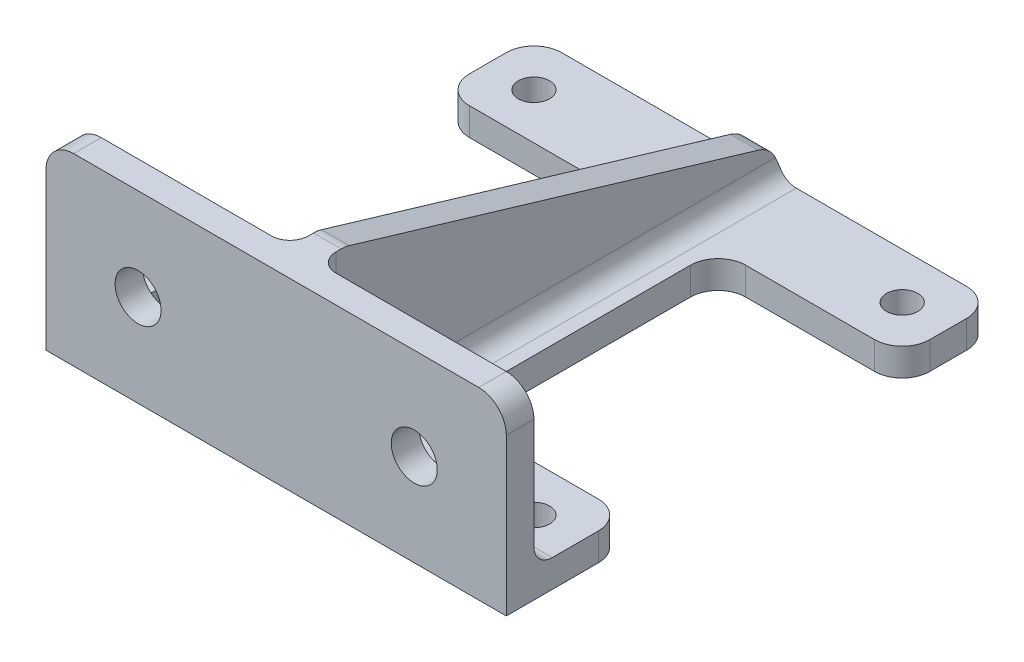
from build123d import *

# Parameters (mm, degrees)
ESQUISSE1_W             = 50
ESQUISSE1_H             = 50
ESQUISSE1_R             = 1.7
BOSS_EXTRU_1_DEPTH      = 3
ESQUISSE2_W             = 50
ESQUISSE2_H             = 20
ESQUISSE2_R             = 2.5
BOSS_EXTRU_2_DEPTH      = 3
BOSS_EXTRU_3_DEPTH      = 1.5
BOSS_EXTRU_3_DEPTH_BACK = 1.5
CONG_1_R                = 3
CONG_2_R                = 3
CONG_3_R                = 2
ESQUISSE4_W             = 20
ESQUISSE4_H             = 30
ENL_V_MAT_EXTRU_1_DEPTH = 73.725511411
CONG_4_R                = 3


with BuildPart() as part:
    # Esquisse1 → Boss.-Extru.1 (new body)
    with BuildSketch(Plane(origin=(0, 0, 0), x_dir=(1, 0, 0), z_dir=(0, 1, 0))):
        with Locations((25, 25)):
            Rectangle(ESQUISSE1_W, ESQUISSE1_H)
        with Locations((5, 5)):
            Circle(ESQUISSE1_R, mode=Mode.SUBTRACT)
        with Locations((5, 45)):
            Circle(ESQUISSE1_R, mode=Mode.SUBTRACT)
        with Locations((45, 45)):
            Circle(ESQUISSE1_R, mode=Mode.SUBTRACT)
        with Locations((45, 5)):
            Circle(ESQUISSE1_R, mode=Mode.SUBTRACT)
    extrude(amount=BOSS_EXTRU_1_DEPTH)

    # Esquisse2 → Boss.-Extru.2 (add)
    with BuildSketch(Plane.XY):
        with Locations((25, 10)):
            Rectangle(ESQUISSE2_W, ESQUISSE2_H)
        with Locations((10, 10)):
            Circle(ESQUISSE2_R, mode=Mode.SUBTRACT)
        with Locations((40, 10)):
            Circle(ESQUISSE2_R, mode=Mode.SUBTRACT)
    extrude(amount=BOSS_EXTRU_2_DEPTH)

    # Esquisse3 → Boss.-Extru.3 (add, two sides: drawn at the far end of the back side and taken through both)
    with BuildSketch(Plane(origin=(25, 0, 0), x_dir=(0, 0, -1), z_dir=(1, 0, 0)).offset(-BOSS_EXTRU_3_DEPTH_BACK)):
        Polygon((0, 20), (3, 20), (50, 6), (50, 3), (0, 3), align=None)
    extrude(amount=BOSS_EXTRU_3_DEPTH + BOSS_EXTRU_3_DEPTH_BACK)

    # Congé1
    cong_1_edges = [part.edges().sort_by_distance(p)[0] for p in [
        (0, 1.5, -50),
        (50, 1.5, -50),
    ]]
    fillet(cong_1_edges, radius=CONG_1_R)

    # Congé2
    cong_2_edges = [part.edges().sort_by_distance(p)[0] for p in [
        (25, 6, -50),
        (25, 20, -3),
        (0, 20, 1.5),
        (50, 20, 1.5),
    ]]
    fillet(cong_2_edges, radius=CONG_2_R)

    # Congé3
    cong_3_edges = [part.edges().sort_by_distance(p)[0] for p in [
        (26.5, 11.5, 0),
    ]]
    fillet(cong_3_edges, radius=CONG_3_R)
    cong_3_2_edges = [part.edges().sort_by_distance(p)[0] for p in [
        (39.25, 3, 0),
    ]]
    fillet(cong_3_2_edges, radius=CONG_3_R)
    cong_3_3_edges = [part.edges().sort_by_distance(p)[0] for p in [
        (23.5, 11.5, 0),
    ]]
    fillet(cong_3_3_edges, radius=CONG_3_R)
    cong_3_4_edges = [part.edges().sort_by_distance(p)[0] for p in [
        (10.75, 3, 0),
    ]]
    fillet(cong_3_4_edges, radius=CONG_3_R)

    # Esquisse4 → Enlèv. mat.-Extru.1 (cut, through all)
    with BuildSketch(Plane(origin=(0, 3, 0), x_dir=(1, 0, 0), z_dir=(0, 1, 0))):
        with Locations((40, 25)):
            Rectangle(ESQUISSE4_W, ESQUISSE4_H)
        with Locations((10, 25)):
            Rectangle(ESQUISSE4_W, ESQUISSE4_H)
    extrude(amount=-ENL_V_MAT_EXTRU_1_DEPTH, mode=Mode.SUBTRACT)

    # Congé4
    cong_4_edges = [part.edges().sort_by_distance(p)[0] for p in [
        (50, 1.5, -10),
        (30, 1.5, -10),
        (30, 1.5, -40),
        (50, 1.5, -40),
        (0, 1.5, -10),
        (20, 1.5, -10),
        (20, 1.5, -40),
        (0, 1.5, -40),
    ]]
    fillet(cong_4_edges, radius=CONG_4_R)


solid = part.part
